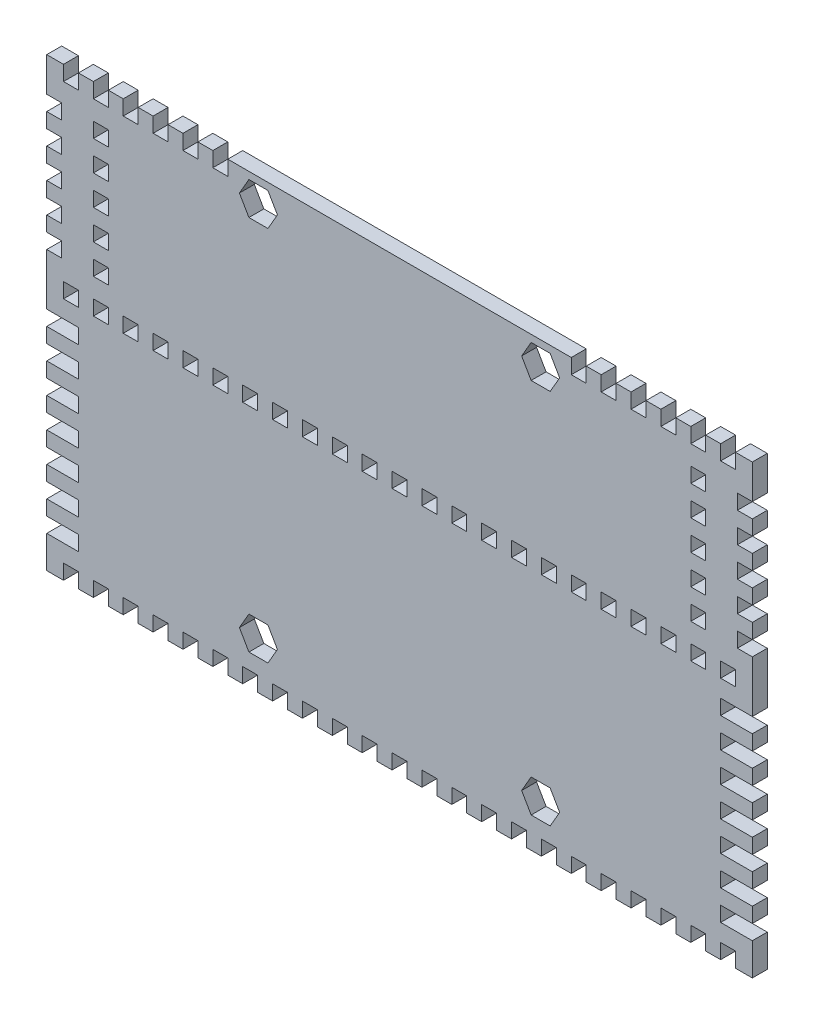
from build123d import *

# Parameters (mm, degrees)
SKETCH1_W                = 150
SKETCH1_H                = 55
BOSS_EXTRUDE1_DEPTH      = 3.175
CUT_EXTRUDE1_REACH       = 81.946
SKETCH2_W                = 3.175
SKETCH2_H                = 6.35
LPATTERN1_COUNT          = 12
LPATTERN1_PITCH          = 6.35
LPATTERN1_COL_COUNT      = 12
LPATTERN1_COL_PITCH      = 6.35
MIRROR1_COPY_1_REACH     = 81.946
MIRROR1_COPY_1_SKETCH_W  = 3.175
MIRROR1_COPY_1_SKETCH_H  = 6.35
MIRROR1_COPY_2_REACH     = 81.946
MIRROR1_COPY_2_SKETCH_W  = 3.175
MIRROR1_COPY_2_SKETCH_H  = 6.35
MIRROR1_COPY_3_REACH     = 81.946
MIRROR1_COPY_3_SKETCH_W  = 3.175
MIRROR1_COPY_3_SKETCH_H  = 6.35
MIRROR1_COPY_4_REACH     = 81.946
MIRROR1_COPY_4_SKETCH_W  = 3.175
MIRROR1_COPY_4_SKETCH_H  = 6.35
MIRROR1_COPY_5_REACH     = 81.946
MIRROR1_COPY_5_SKETCH_W  = 3.175
MIRROR1_COPY_5_SKETCH_H  = 6.35
MIRROR1_COPY_6_REACH     = 81.946
MIRROR1_COPY_6_SKETCH_W  = 3.175
MIRROR1_COPY_6_SKETCH_H  = 6.35
MIRROR1_COPY_7_REACH     = 81.946
MIRROR1_COPY_7_SKETCH_W  = 3.175
MIRROR1_COPY_7_SKETCH_H  = 6.35
MIRROR1_COPY_8_REACH     = 81.946
MIRROR1_COPY_8_SKETCH_W  = 3.175
MIRROR1_COPY_8_SKETCH_H  = 6.35
MIRROR1_COPY_9_REACH     = 81.946
MIRROR1_COPY_9_SKETCH_W  = 3.175
MIRROR1_COPY_9_SKETCH_H  = 6.35
MIRROR1_COPY_10_REACH    = 81.946
MIRROR1_COPY_10_SKETCH_W = 3.175
MIRROR1_COPY_10_SKETCH_H = 6.35
MIRROR1_COPY_11_REACH    = 81.946
MIRROR1_COPY_11_SKETCH_W = 3.175
MIRROR1_COPY_11_SKETCH_H = 6.35
MIRROR1_COPY_12_REACH    = 81.946
MIRROR1_COPY_12_SKETCH_W = 3.175
MIRROR1_COPY_12_SKETCH_H = 6.35
MIRROR1_COPY_13_REACH    = 81.946
MIRROR1_COPY_13_SKETCH_W = 3.175
MIRROR1_COPY_13_SKETCH_H = 6.35
MIRROR1_COPY_14_REACH    = 81.946
MIRROR1_COPY_14_SKETCH_W = 3.175
MIRROR1_COPY_14_SKETCH_H = 6.35
MIRROR1_COPY_15_REACH    = 81.946
MIRROR1_COPY_15_SKETCH_W = 3.175
MIRROR1_COPY_15_SKETCH_H = 6.35
MIRROR1_COPY_16_REACH    = 81.946
MIRROR1_COPY_16_SKETCH_W = 3.175
MIRROR1_COPY_16_SKETCH_H = 6.35
MIRROR1_COPY_17_REACH    = 81.946
MIRROR1_COPY_17_SKETCH_W = 3.175
MIRROR1_COPY_17_SKETCH_H = 6.35
MIRROR1_COPY_18_REACH    = 81.946
MIRROR1_COPY_18_SKETCH_W = 3.175
MIRROR1_COPY_18_SKETCH_H = 6.35
MIRROR1_COPY_19_REACH    = 81.946
MIRROR1_COPY_19_SKETCH_W = 3.175
MIRROR1_COPY_19_SKETCH_H = 6.35
MIRROR1_COPY_20_REACH    = 81.946
MIRROR1_COPY_20_SKETCH_W = 3.175
MIRROR1_COPY_20_SKETCH_H = 6.35
MIRROR1_COPY_21_REACH    = 81.946
MIRROR1_COPY_21_SKETCH_W = 3.175
MIRROR1_COPY_21_SKETCH_H = 6.35
MIRROR1_COPY_22_REACH    = 81.946
MIRROR1_COPY_22_SKETCH_W = 3.175
MIRROR1_COPY_22_SKETCH_H = 6.35
SKETCH3_W                = 6.35
SKETCH3_H                = 3.175
CUT_EXTRUDE2_DEPTH       = 10
LPATTERN2_COUNT          = 4
LPATTERN2_PITCH          = 6.35
LPATTERN2_COL_COUNT      = 4
LPATTERN2_COL_PITCH      = 6.35
MIRROR2_COPY_1_SKETCH_W  = 6.35
MIRROR2_COPY_1_SKETCH_H  = 3.175
MIRROR2_COPY_1_DEPTH     = 10
MIRROR2_COPY_2_SKETCH_W  = 6.35
MIRROR2_COPY_2_SKETCH_H  = 3.175
MIRROR2_COPY_2_DEPTH     = 10
MIRROR2_COPY_3_SKETCH_W  = 6.35
MIRROR2_COPY_3_SKETCH_H  = 3.175
MIRROR2_COPY_3_DEPTH     = 10
MIRROR2_COPY_4_SKETCH_W  = 6.35
MIRROR2_COPY_4_SKETCH_H  = 3.175
MIRROR2_COPY_4_DEPTH     = 10
MIRROR2_COPY_5_SKETCH_W  = 6.35
MIRROR2_COPY_5_SKETCH_H  = 3.175
MIRROR2_COPY_5_DEPTH     = 10
MIRROR2_COPY_6_SKETCH_W  = 6.35
MIRROR2_COPY_6_SKETCH_H  = 3.175
MIRROR2_COPY_6_DEPTH     = 10
SKETCH5_W                = 150
SKETCH5_H                = 40
BOSS_EXTRUDE2_DEPTH      = 3.175
CUT_EXTRUDE5_DEPTH       = 10
LPATTERN3_COUNT          = 12
LPATTERN3_PITCH          = 6.35
LPATTERN3_COL_COUNT      = 12
LPATTERN3_COL_PITCH      = 6.35
SKETCH8_W                = 3.5625
SKETCH8_H                = 3.175
CUT_EXTRUDE6_DEPTH       = 10
LPATTERN4_COUNT          = 7
LPATTERN4_PITCH          = 6.35
MIRROR3_COPY_1_SKETCH_W  = 3.5625
MIRROR3_COPY_1_SKETCH_H  = 3.175
MIRROR3_COPY_1_DEPTH     = 10
MIRROR3_COPY_2_SKETCH_W  = 3.5625
MIRROR3_COPY_2_SKETCH_H  = 3.175
MIRROR3_COPY_2_DEPTH     = 10
MIRROR3_COPY_3_SKETCH_W  = 3.5625
MIRROR3_COPY_3_SKETCH_H  = 3.175
MIRROR3_COPY_3_DEPTH     = 10
MIRROR3_COPY_4_SKETCH_W  = 3.5625
MIRROR3_COPY_4_SKETCH_H  = 3.175
MIRROR3_COPY_4_DEPTH     = 10
MIRROR3_COPY_5_SKETCH_W  = 3.5625
MIRROR3_COPY_5_SKETCH_H  = 3.175
MIRROR3_COPY_5_DEPTH     = 10
MIRROR3_COPY_6_SKETCH_W  = 3.5625
MIRROR3_COPY_6_SKETCH_H  = 3.175
MIRROR3_COPY_6_DEPTH     = 10
SKETCH11_W               = 73.025
SKETCH11_H               = 3.175
BOSS_EXTRUDE3_DEPTH      = 3.175
SKETCH10_R               = 2.5
CUT_EXTRUDE7_DEPTH       = 10
SKETCH12_W               = 6.35
SKETCH12_H               = 3.175
CUT_EXTRUDE8_DEPTH       = 10
LPATTERN5_COUNT          = 3
LPATTERN5_PITCH          = 6.35
LPATTERN5_COL_COUNT      = 3
LPATTERN5_COL_PITCH      = 6.35
MIRROR4_COPY_1_SKETCH_W  = 6.35
MIRROR4_COPY_1_SKETCH_H  = 3.175
MIRROR4_COPY_1_DEPTH     = 10
MIRROR4_COPY_2_SKETCH_W  = 6.35
MIRROR4_COPY_2_SKETCH_H  = 3.175
MIRROR4_COPY_2_DEPTH     = 10
MIRROR4_COPY_3_SKETCH_W  = 6.35
MIRROR4_COPY_3_SKETCH_H  = 3.175
MIRROR4_COPY_3_DEPTH     = 10
MIRROR4_COPY_4_SKETCH_W  = 6.35
MIRROR4_COPY_4_SKETCH_H  = 3.175
MIRROR4_COPY_4_DEPTH     = 10
SKETCH13_W               = 3.175
SKETCH13_H               = 3.175
CUT_EXTRUDE9_DEPTH       = 10
LPATTERN6_COUNT          = 3
LPATTERN6_PITCH          = 6.35
LPATTERN6_COL_COUNT      = 3
LPATTERN6_COL_PITCH      = 6.35
MIRROR5_COPY_1_SKETCH_W  = 3.175
MIRROR5_COPY_1_SKETCH_H  = 3.175
MIRROR5_COPY_1_DEPTH     = 10
MIRROR5_COPY_2_SKETCH_W  = 3.175
MIRROR5_COPY_2_SKETCH_H  = 3.175
MIRROR5_COPY_2_DEPTH     = 10
MIRROR5_COPY_3_SKETCH_W  = 3.175
MIRROR5_COPY_3_SKETCH_H  = 3.175
MIRROR5_COPY_3_DEPTH     = 10
MIRROR5_COPY_4_SKETCH_W  = 3.175
MIRROR5_COPY_4_SKETCH_H  = 3.175
MIRROR5_COPY_4_DEPTH     = 10
CUT_EXTRUDE10_DEPTH      = 10


with BuildPart() as part:
    # Sketch1 → Boss-Extrude1 (new body)
    with BuildSketch(Plane.XY):
        Rectangle(SKETCH1_W, SKETCH1_H)
    extrude(amount=BOSS_EXTRUDE1_DEPTH)

    # Sketch2 → Cut-Extrude1 (cut, up to next)
    with BuildSketch(Plane(origin=(0, 0, 0), x_dir=(-1, 0, 0), z_dir=(0, 0, -1)), mode=Mode.PRIVATE) as cut_extrude1_sk1:
        with Locations((0, 27.5)):
            Rectangle(SKETCH2_W, SKETCH2_H)
    cut_extrude1_tool1 = extrude(cut_extrude1_sk1.sketch, amount=-CUT_EXTRUDE1_REACH, mode=Mode.PRIVATE) & part.part
    cut_extrude1 = cut_extrude1_tool1.solids().sort_by_distance((0, 27.5, 0))[0]
    add(cut_extrude1, mode=Mode.SUBTRACT)

    # LPattern1: Cut-Extrude1 ×12
    with Locations(*[(i * LPATTERN1_PITCH, 0, 0) for i in range(1, LPATTERN1_COUNT)]):
        add(cut_extrude1, mode=Mode.SUBTRACT)

    # LPattern1 col: Cut-Extrude1 ×12
    with Locations(*[(-i * LPATTERN1_COL_PITCH, 0, 0) for i in range(1, LPATTERN1_COL_COUNT)]):
        add(cut_extrude1, mode=Mode.SUBTRACT)

    # Mirror1: Cut-Extrude1 across plane
    add(cut_extrude1.mirror(Plane.ZX), mode=Mode.SUBTRACT)

    # Mirror1 copy 1 sketch → Mirror1 copy 1 (cut, up to next)
    with BuildSketch(Plane(origin=(6.35, 0, 0), x_dir=(-1, 0, 0), z_dir=(0, 0, -1)), mode=Mode.PRIVATE) as mirror1_copy_1_sk1:
        with Locations((0, -27.5)):
            Rectangle(MIRROR1_COPY_1_SKETCH_W, MIRROR1_COPY_1_SKETCH_H)
    mirror1_copy_1_tool1 = extrude(mirror1_copy_1_sk1.sketch, amount=-MIRROR1_COPY_1_REACH, mode=Mode.PRIVATE) & part.part
    add(mirror1_copy_1_tool1.solids().sort_by_distance((6.35, -27.5, 0))[0], mode=Mode.SUBTRACT)

    # Mirror1 copy 2 sketch → Mirror1 copy 2 (cut, up to next)
    with BuildSketch(Plane(origin=(12.7, 0, 0), x_dir=(-1, 0, 0), z_dir=(0, 0, -1)), mode=Mode.PRIVATE) as mirror1_copy_2_sk1:
        with Locations((0, -27.5)):
            Rectangle(MIRROR1_COPY_2_SKETCH_W, MIRROR1_COPY_2_SKETCH_H)
    mirror1_copy_2_tool1 = extrude(mirror1_copy_2_sk1.sketch, amount=-MIRROR1_COPY_2_REACH, mode=Mode.PRIVATE) & part.part
    add(mirror1_copy_2_tool1.solids().sort_by_distance((12.7, -27.5, 0))[0], mode=Mode.SUBTRACT)

    # Mirror1 copy 3 sketch → Mirror1 copy 3 (cut, up to next)
    with BuildSketch(Plane(origin=(19.05, 0, 0), x_dir=(-1, 0, 0), z_dir=(0, 0, -1)), mode=Mode.PRIVATE) as mirror1_copy_3_sk1:
        with Locations((0, -27.5)):
            Rectangle(MIRROR1_COPY_3_SKETCH_W, MIRROR1_COPY_3_SKETCH_H)
    mirror1_copy_3_tool1 = extrude(mirror1_copy_3_sk1.sketch, amount=-MIRROR1_COPY_3_REACH, mode=Mode.PRIVATE) & part.part
    add(mirror1_copy_3_tool1.solids().sort_by_distance((19.05, -27.5, 0))[0], mode=Mode.SUBTRACT)

    # Mirror1 copy 4 sketch → Mirror1 copy 4 (cut, up to next)
    with BuildSketch(Plane(origin=(25.4, 0, 0), x_dir=(-1, 0, 0), z_dir=(0, 0, -1)), mode=Mode.PRIVATE) as mirror1_copy_4_sk1:
        with Locations((0, -27.5)):
            Rectangle(MIRROR1_COPY_4_SKETCH_W, MIRROR1_COPY_4_SKETCH_H)
    mirror1_copy_4_tool1 = extrude(mirror1_copy_4_sk1.sketch, amount=-MIRROR1_COPY_4_REACH, mode=Mode.PRIVATE) & part.part
    add(mirror1_copy_4_tool1.solids().sort_by_distance((25.4, -27.5, 0))[0], mode=Mode.SUBTRACT)

    # Mirror1 copy 5 sketch → Mirror1 copy 5 (cut, up to next)
    with BuildSketch(Plane(origin=(31.75, 0, 0), x_dir=(-1, 0, 0), z_dir=(0, 0, -1)), mode=Mode.PRIVATE) as mirror1_copy_5_sk1:
        with Locations((0, -27.5)):
            Rectangle(MIRROR1_COPY_5_SKETCH_W, MIRROR1_COPY_5_SKETCH_H)
    mirror1_copy_5_tool1 = extrude(mirror1_copy_5_sk1.sketch, amount=-MIRROR1_COPY_5_REACH, mode=Mode.PRIVATE) & part.part
    add(mirror1_copy_5_tool1.solids().sort_by_distance((31.75, -27.5, 0))[0], mode=Mode.SUBTRACT)

    # Mirror1 copy 6 sketch → Mirror1 copy 6 (cut, up to next)
    with BuildSketch(Plane(origin=(38.1, 0, 0), x_dir=(-1, 0, 0), z_dir=(0, 0, -1)), mode=Mode.PRIVATE) as mirror1_copy_6_sk1:
        with Locations((0, -27.5)):
            Rectangle(MIRROR1_COPY_6_SKETCH_W, MIRROR1_COPY_6_SKETCH_H)
    mirror1_copy_6_tool1 = extrude(mirror1_copy_6_sk1.sketch, amount=-MIRROR1_COPY_6_REACH, mode=Mode.PRIVATE) & part.part
    add(mirror1_copy_6_tool1.solids().sort_by_distance((38.1, -27.5, 0))[0], mode=Mode.SUBTRACT)

    # Mirror1 copy 7 sketch → Mirror1 copy 7 (cut, up to next)
    with BuildSketch(Plane(origin=(44.45, 0, 0), x_dir=(-1, 0, 0), z_dir=(0, 0, -1)), mode=Mode.PRIVATE) as mirror1_copy_7_sk1:
        with Locations((0, -27.5)):
            Rectangle(MIRROR1_COPY_7_SKETCH_W, MIRROR1_COPY_7_SKETCH_H)
    mirror1_copy_7_tool1 = extrude(mirror1_copy_7_sk1.sketch, amount=-MIRROR1_COPY_7_REACH, mode=Mode.PRIVATE) & part.part
    add(mirror1_copy_7_tool1.solids().sort_by_distance((44.45, -27.5, 0))[0], mode=Mode.SUBTRACT)

    # Mirror1 copy 8 sketch → Mirror1 copy 8 (cut, up to next)
    with BuildSketch(Plane(origin=(50.8, 0, 0), x_dir=(-1, 0, 0), z_dir=(0, 0, -1)), mode=Mode.PRIVATE) as mirror1_copy_8_sk1:
        with Locations((0, -27.5)):
            Rectangle(MIRROR1_COPY_8_SKETCH_W, MIRROR1_COPY_8_SKETCH_H)
    mirror1_copy_8_tool1 = extrude(mirror1_copy_8_sk1.sketch, amount=-MIRROR1_COPY_8_REACH, mode=Mode.PRIVATE) & part.part
    add(mirror1_copy_8_tool1.solids().sort_by_distance((50.8, -27.5, 0))[0], mode=Mode.SUBTRACT)

    # Mirror1 copy 9 sketch → Mirror1 copy 9 (cut, up to next)
    with BuildSketch(Plane(origin=(57.15, 0, 0), x_dir=(-1, 0, 0), z_dir=(0, 0, -1)), mode=Mode.PRIVATE) as mirror1_copy_9_sk1:
        with Locations((0, -27.5)):
            Rectangle(MIRROR1_COPY_9_SKETCH_W, MIRROR1_COPY_9_SKETCH_H)
    mirror1_copy_9_tool1 = extrude(mirror1_copy_9_sk1.sketch, amount=-MIRROR1_COPY_9_REACH, mode=Mode.PRIVATE) & part.part
    add(mirror1_copy_9_tool1.solids().sort_by_distance((57.15, -27.5, 0))[0], mode=Mode.SUBTRACT)

    # Mirror1 copy 10 sketch → Mirror1 copy 10 (cut, up to next)
    with BuildSketch(Plane(origin=(63.5, 0, 0), x_dir=(-1, 0, 0), z_dir=(0, 0, -1)), mode=Mode.PRIVATE) as mirror1_copy_10_sk1:
        with Locations((0, -27.5)):
            Rectangle(MIRROR1_COPY_10_SKETCH_W, MIRROR1_COPY_10_SKETCH_H)
    mirror1_copy_10_tool1 = extrude(mirror1_copy_10_sk1.sketch, amount=-MIRROR1_COPY_10_REACH, mode=Mode.PRIVATE) & part.part
    add(mirror1_copy_10_tool1.solids().sort_by_distance((63.5, -27.5, 0))[0], mode=Mode.SUBTRACT)

    # Mirror1 copy 11 sketch → Mirror1 copy 11 (cut, up to next)
    with BuildSketch(Plane(origin=(69.85, 0, 0), x_dir=(-1, 0, 0), z_dir=(0, 0, -1)), mode=Mode.PRIVATE) as mirror1_copy_11_sk1:
        with Locations((0, -27.5)):
            Rectangle(MIRROR1_COPY_11_SKETCH_W, MIRROR1_COPY_11_SKETCH_H)
    mirror1_copy_11_tool1 = extrude(mirror1_copy_11_sk1.sketch, amount=-MIRROR1_COPY_11_REACH, mode=Mode.PRIVATE) & part.part
    add(mirror1_copy_11_tool1.solids().sort_by_distance((69.85, -27.5, 0))[0], mode=Mode.SUBTRACT)

    # Mirror1 copy 12 sketch → Mirror1 copy 12 (cut, up to next)
    with BuildSketch(Plane(origin=(-6.35, 0, 0), x_dir=(-1, 0, 0), z_dir=(0, 0, -1)), mode=Mode.PRIVATE) as mirror1_copy_12_sk1:
        with Locations((0, -27.5)):
            Rectangle(MIRROR1_COPY_12_SKETCH_W, MIRROR1_COPY_12_SKETCH_H)
    mirror1_copy_12_tool1 = extrude(mirror1_copy_12_sk1.sketch, amount=-MIRROR1_COPY_12_REACH, mode=Mode.PRIVATE) & part.part
    add(mirror1_copy_12_tool1.solids().sort_by_distance((-6.35, -27.5, 0))[0], mode=Mode.SUBTRACT)

    # Mirror1 copy 13 sketch → Mirror1 copy 13 (cut, up to next)
    with BuildSketch(Plane(origin=(-12.7, 0, 0), x_dir=(-1, 0, 0), z_dir=(0, 0, -1)), mode=Mode.PRIVATE) as mirror1_copy_13_sk1:
        with Locations((0, -27.5)):
            Rectangle(MIRROR1_COPY_13_SKETCH_W, MIRROR1_COPY_13_SKETCH_H)
    mirror1_copy_13_tool1 = extrude(mirror1_copy_13_sk1.sketch, amount=-MIRROR1_COPY_13_REACH, mode=Mode.PRIVATE) & part.part
    add(mirror1_copy_13_tool1.solids().sort_by_distance((-12.7, -27.5, 0))[0], mode=Mode.SUBTRACT)

    # Mirror1 copy 14 sketch → Mirror1 copy 14 (cut, up to next)
    with BuildSketch(Plane(origin=(-19.05, 0, 0), x_dir=(-1, 0, 0), z_dir=(0, 0, -1)), mode=Mode.PRIVATE) as mirror1_copy_14_sk1:
        with Locations((0, -27.5)):
            Rectangle(MIRROR1_COPY_14_SKETCH_W, MIRROR1_COPY_14_SKETCH_H)
    mirror1_copy_14_tool1 = extrude(mirror1_copy_14_sk1.sketch, amount=-MIRROR1_COPY_14_REACH, mode=Mode.PRIVATE) & part.part
    add(mirror1_copy_14_tool1.solids().sort_by_distance((-19.05, -27.5, 0))[0], mode=Mode.SUBTRACT)

    # Mirror1 copy 15 sketch → Mirror1 copy 15 (cut, up to next)
    with BuildSketch(Plane(origin=(-25.4, 0, 0), x_dir=(-1, 0, 0), z_dir=(0, 0, -1)), mode=Mode.PRIVATE) as mirror1_copy_15_sk1:
        with Locations((0, -27.5)):
            Rectangle(MIRROR1_COPY_15_SKETCH_W, MIRROR1_COPY_15_SKETCH_H)
    mirror1_copy_15_tool1 = extrude(mirror1_copy_15_sk1.sketch, amount=-MIRROR1_COPY_15_REACH, mode=Mode.PRIVATE) & part.part
    add(mirror1_copy_15_tool1.solids().sort_by_distance((-25.4, -27.5, 0))[0], mode=Mode.SUBTRACT)

    # Mirror1 copy 16 sketch → Mirror1 copy 16 (cut, up to next)
    with BuildSketch(Plane(origin=(-31.75, 0, 0), x_dir=(-1, 0, 0), z_dir=(0, 0, -1)), mode=Mode.PRIVATE) as mirror1_copy_16_sk1:
        with Locations((0, -27.5)):
            Rectangle(MIRROR1_COPY_16_SKETCH_W, MIRROR1_COPY_16_SKETCH_H)
    mirror1_copy_16_tool1 = extrude(mirror1_copy_16_sk1.sketch, amount=-MIRROR1_COPY_16_REACH, mode=Mode.PRIVATE) & part.part
    add(mirror1_copy_16_tool1.solids().sort_by_distance((-31.75, -27.5, 0))[0], mode=Mode.SUBTRACT)

    # Mirror1 copy 17 sketch → Mirror1 copy 17 (cut, up to next)
    with BuildSketch(Plane(origin=(-38.1, 0, 0), x_dir=(-1, 0, 0), z_dir=(0, 0, -1)), mode=Mode.PRIVATE) as mirror1_copy_17_sk1:
        with Locations((0, -27.5)):
            Rectangle(MIRROR1_COPY_17_SKETCH_W, MIRROR1_COPY_17_SKETCH_H)
    mirror1_copy_17_tool1 = extrude(mirror1_copy_17_sk1.sketch, amount=-MIRROR1_COPY_17_REACH, mode=Mode.PRIVATE) & part.part
    add(mirror1_copy_17_tool1.solids().sort_by_distance((-38.1, -27.5, 0))[0], mode=Mode.SUBTRACT)

    # Mirror1 copy 18 sketch → Mirror1 copy 18 (cut, up to next)
    with BuildSketch(Plane(origin=(-44.45, 0, 0), x_dir=(-1, 0, 0), z_dir=(0, 0, -1)), mode=Mode.PRIVATE) as mirror1_copy_18_sk1:
        with Locations((0, -27.5)):
            Rectangle(MIRROR1_COPY_18_SKETCH_W, MIRROR1_COPY_18_SKETCH_H)
    mirror1_copy_18_tool1 = extrude(mirror1_copy_18_sk1.sketch, amount=-MIRROR1_COPY_18_REACH, mode=Mode.PRIVATE) & part.part
    add(mirror1_copy_18_tool1.solids().sort_by_distance((-44.45, -27.5, 0))[0], mode=Mode.SUBTRACT)

    # Mirror1 copy 19 sketch → Mirror1 copy 19 (cut, up to next)
    with BuildSketch(Plane(origin=(-50.8, 0, 0), x_dir=(-1, 0, 0), z_dir=(0, 0, -1)), mode=Mode.PRIVATE) as mirror1_copy_19_sk1:
        with Locations((0, -27.5)):
            Rectangle(MIRROR1_COPY_19_SKETCH_W, MIRROR1_COPY_19_SKETCH_H)
    mirror1_copy_19_tool1 = extrude(mirror1_copy_19_sk1.sketch, amount=-MIRROR1_COPY_19_REACH, mode=Mode.PRIVATE) & part.part
    add(mirror1_copy_19_tool1.solids().sort_by_distance((-50.8, -27.5, 0))[0], mode=Mode.SUBTRACT)

    # Mirror1 copy 20 sketch → Mirror1 copy 20 (cut, up to next)
    with BuildSketch(Plane(origin=(-57.15, 0, 0), x_dir=(-1, 0, 0), z_dir=(0, 0, -1)), mode=Mode.PRIVATE) as mirror1_copy_20_sk1:
        with Locations((0, -27.5)):
            Rectangle(MIRROR1_COPY_20_SKETCH_W, MIRROR1_COPY_20_SKETCH_H)
    mirror1_copy_20_tool1 = extrude(mirror1_copy_20_sk1.sketch, amount=-MIRROR1_COPY_20_REACH, mode=Mode.PRIVATE) & part.part
    add(mirror1_copy_20_tool1.solids().sort_by_distance((-57.15, -27.5, 0))[0], mode=Mode.SUBTRACT)

    # Mirror1 copy 21 sketch → Mirror1 copy 21 (cut, up to next)
    with BuildSketch(Plane(origin=(-63.5, 0, 0), x_dir=(-1, 0, 0), z_dir=(0, 0, -1)), mode=Mode.PRIVATE) as mirror1_copy_21_sk1:
        with Locations((0, -27.5)):
            Rectangle(MIRROR1_COPY_21_SKETCH_W, MIRROR1_COPY_21_SKETCH_H)
    mirror1_copy_21_tool1 = extrude(mirror1_copy_21_sk1.sketch, amount=-MIRROR1_COPY_21_REACH, mode=Mode.PRIVATE) & part.part
    add(mirror1_copy_21_tool1.solids().sort_by_distance((-63.5, -27.5, 0))[0], mode=Mode.SUBTRACT)

    # Mirror1 copy 22 sketch → Mirror1 copy 22 (cut, up to next)
    with BuildSketch(Plane(origin=(-69.85, 0, 0), x_dir=(-1, 0, 0), z_dir=(0, 0, -1)), mode=Mode.PRIVATE) as mirror1_copy_22_sk1:
        with Locations((0, -27.5)):
            Rectangle(MIRROR1_COPY_22_SKETCH_W, MIRROR1_COPY_22_SKETCH_H)
    mirror1_copy_22_tool1 = extrude(mirror1_copy_22_sk1.sketch, amount=-MIRROR1_COPY_22_REACH, mode=Mode.PRIVATE) & part.part
    add(mirror1_copy_22_tool1.solids().sort_by_distance((-69.85, -27.5, 0))[0], mode=Mode.SUBTRACT)

    # Sketch3 → Cut-Extrude2 (cut)
    with BuildSketch(Plane(origin=(0, 0, 0), x_dir=(-1, 0, 0), z_dir=(0, 0, -1))):
        with Locations((-75, 0)):
            Rectangle(SKETCH3_W, SKETCH3_H)
    cut_extrude2 = extrude(amount=-CUT_EXTRUDE2_DEPTH, mode=Mode.SUBTRACT)

    # LPattern2: Cut-Extrude2 ×4
    with Locations(*[(0, i * LPATTERN2_PITCH, 0) for i in range(1, LPATTERN2_COUNT)]):
        add(cut_extrude2, mode=Mode.SUBTRACT)

    # LPattern2 col: Cut-Extrude2 ×4
    with Locations(*[(0, -i * LPATTERN2_COL_PITCH, 0) for i in range(1, LPATTERN2_COL_COUNT)]):
        add(cut_extrude2, mode=Mode.SUBTRACT)

    # Mirror2: Cut-Extrude2 across plane
    add(cut_extrude2.mirror(Plane(origin=(0, 0, 0), x_dir=(0, 0, 1), z_dir=(1, 0, 0))), mode=Mode.SUBTRACT)

    # Mirror2 copy 1 sketch → Mirror2 copy 1 (cut)
    with BuildSketch(Plane(origin=(0, 6.35, 0), x_dir=(1, 0, 0), z_dir=(0, 0, -1))):
        with Locations((-75, 0)):
            Rectangle(MIRROR2_COPY_1_SKETCH_W, MIRROR2_COPY_1_SKETCH_H)
    extrude(amount=-MIRROR2_COPY_1_DEPTH, mode=Mode.SUBTRACT)

    # Mirror2 copy 2 sketch → Mirror2 copy 2 (cut)
    with BuildSketch(Plane(origin=(0, 12.7, 0), x_dir=(1, 0, 0), z_dir=(0, 0, -1))):
        with Locations((-75, 0)):
            Rectangle(MIRROR2_COPY_2_SKETCH_W, MIRROR2_COPY_2_SKETCH_H)
    extrude(amount=-MIRROR2_COPY_2_DEPTH, mode=Mode.SUBTRACT)

    # Mirror2 copy 3 sketch → Mirror2 copy 3 (cut)
    with BuildSketch(Plane(origin=(0, 19.05, 0), x_dir=(1, 0, 0), z_dir=(0, 0, -1))):
        with Locations((-75, 0)):
            Rectangle(MIRROR2_COPY_3_SKETCH_W, MIRROR2_COPY_3_SKETCH_H)
    extrude(amount=-MIRROR2_COPY_3_DEPTH, mode=Mode.SUBTRACT)

    # Mirror2 copy 4 sketch → Mirror2 copy 4 (cut)
    with BuildSketch(Plane(origin=(0, -6.35, 0), x_dir=(1, 0, 0), z_dir=(0, 0, -1))):
        with Locations((-75, 0)):
            Rectangle(MIRROR2_COPY_4_SKETCH_W, MIRROR2_COPY_4_SKETCH_H)
    extrude(amount=-MIRROR2_COPY_4_DEPTH, mode=Mode.SUBTRACT)

    # Mirror2 copy 5 sketch → Mirror2 copy 5 (cut)
    with BuildSketch(Plane(origin=(0, -12.7, 0), x_dir=(1, 0, 0), z_dir=(0, 0, -1))):
        with Locations((-75, 0)):
            Rectangle(MIRROR2_COPY_5_SKETCH_W, MIRROR2_COPY_5_SKETCH_H)
    extrude(amount=-MIRROR2_COPY_5_DEPTH, mode=Mode.SUBTRACT)

    # Mirror2 copy 6 sketch → Mirror2 copy 6 (cut)
    with BuildSketch(Plane(origin=(0, -19.05, 0), x_dir=(1, 0, 0), z_dir=(0, 0, -1))):
        with Locations((-75, 0)):
            Rectangle(MIRROR2_COPY_6_SKETCH_W, MIRROR2_COPY_6_SKETCH_H)
    extrude(amount=-MIRROR2_COPY_6_DEPTH, mode=Mode.SUBTRACT)

    # Sketch5 → Boss-Extrude2 (add)
    with BuildSketch(Plane(origin=(0, 0, 0), x_dir=(-1, 0, 0), z_dir=(0, 0, -1))):
        with Locations((0, 47.5)):
            Rectangle(SKETCH5_W, SKETCH5_H)
    extrude(amount=-BOSS_EXTRUDE2_DEPTH)

    # Sketch7 → Cut-Extrude5 (cut)
    with BuildSketch(Plane(origin=(0, 0, 0), x_dir=(-1, 0, 0), z_dir=(0, 0, -1))):
        Polygon((0, 67.5), (1.5875, 67.5), (1.5875, 64.325), (0, 64.325), (-1.5875, 64.325), (-1.5875, 67.5), align=None)
    cut_extrude5 = extrude(amount=-CUT_EXTRUDE5_DEPTH, mode=Mode.SUBTRACT)

    # LPattern3: Cut-Extrude5 ×12
    with Locations(*[(i * LPATTERN3_PITCH, 0, 0) for i in range(1, LPATTERN3_COUNT)]):
        add(cut_extrude5, mode=Mode.SUBTRACT)

    # LPattern3 col: Cut-Extrude5 ×12
    with Locations(*[(-i * LPATTERN3_COL_PITCH, 0, 0) for i in range(1, LPATTERN3_COL_COUNT)]):
        add(cut_extrude5, mode=Mode.SUBTRACT)

    # Sketch8 → Cut-Extrude6 (cut)
    with BuildSketch(Plane(origin=(0, 0, 0), x_dir=(-1, 0, 0), z_dir=(0, 0, -1))):
        with Locations((-70.04375, 19.05)):
            Rectangle(SKETCH8_W, SKETCH8_H)
    cut_extrude6 = extrude(amount=-CUT_EXTRUDE6_DEPTH, mode=Mode.SUBTRACT)

    # LPattern4: Cut-Extrude6 ×7
    with Locations(*[(0, -i * LPATTERN4_PITCH, 0) for i in range(1, LPATTERN4_COUNT)]):
        add(cut_extrude6, mode=Mode.SUBTRACT)

    # Mirror3: Cut-Extrude6 across plane
    add(cut_extrude6.mirror(Plane(origin=(0, 0, 0), x_dir=(0, 0, 1), z_dir=(1, 0, 0))), mode=Mode.SUBTRACT)

    # Mirror3 copy 1 sketch → Mirror3 copy 1 (cut)
    with BuildSketch(Plane(origin=(0, -6.35, 0), x_dir=(1, 0, 0), z_dir=(0, 0, -1))):
        with Locations((-70.04375, -19.05)):
            Rectangle(MIRROR3_COPY_1_SKETCH_W, MIRROR3_COPY_1_SKETCH_H)
    extrude(amount=-MIRROR3_COPY_1_DEPTH, mode=Mode.SUBTRACT)

    # Mirror3 copy 2 sketch → Mirror3 copy 2 (cut)
    with BuildSketch(Plane(origin=(0, -12.7, 0), x_dir=(1, 0, 0), z_dir=(0, 0, -1))):
        with Locations((-70.04375, -19.05)):
            Rectangle(MIRROR3_COPY_2_SKETCH_W, MIRROR3_COPY_2_SKETCH_H)
    extrude(amount=-MIRROR3_COPY_2_DEPTH, mode=Mode.SUBTRACT)

    # Mirror3 copy 3 sketch → Mirror3 copy 3 (cut)
    with BuildSketch(Plane(origin=(0, -19.05, 0), x_dir=(1, 0, 0), z_dir=(0, 0, -1))):
        with Locations((-70.04375, -19.05)):
            Rectangle(MIRROR3_COPY_3_SKETCH_W, MIRROR3_COPY_3_SKETCH_H)
    extrude(amount=-MIRROR3_COPY_3_DEPTH, mode=Mode.SUBTRACT)

    # Mirror3 copy 4 sketch → Mirror3 copy 4 (cut)
    with BuildSketch(Plane(origin=(0, -25.4, 0), x_dir=(1, 0, 0), z_dir=(0, 0, -1))):
        with Locations((-70.04375, -19.05)):
            Rectangle(MIRROR3_COPY_4_SKETCH_W, MIRROR3_COPY_4_SKETCH_H)
    extrude(amount=-MIRROR3_COPY_4_DEPTH, mode=Mode.SUBTRACT)

    # Mirror3 copy 5 sketch → Mirror3 copy 5 (cut)
    with BuildSketch(Plane(origin=(0, -31.75, 0), x_dir=(1, 0, 0), z_dir=(0, 0, -1))):
        with Locations((-70.04375, -19.05)):
            Rectangle(MIRROR3_COPY_5_SKETCH_W, MIRROR3_COPY_5_SKETCH_H)
    extrude(amount=-MIRROR3_COPY_5_DEPTH, mode=Mode.SUBTRACT)

    # Mirror3 copy 6 sketch → Mirror3 copy 6 (cut)
    with BuildSketch(Plane(origin=(0, -38.1, 0), x_dir=(1, 0, 0), z_dir=(0, 0, -1))):
        with Locations((-70.04375, -19.05)):
            Rectangle(MIRROR3_COPY_6_SKETCH_W, MIRROR3_COPY_6_SKETCH_H)
    extrude(amount=-MIRROR3_COPY_6_DEPTH, mode=Mode.SUBTRACT)

    # Sketch11 → Boss-Extrude3 (add)
    with BuildSketch(Plane(origin=(0, 0, 0), x_dir=(-1, 0, 0), z_dir=(0, 0, -1))):
        with Locations((0, 65.9125)):
            Rectangle(SKETCH11_W, SKETCH11_H)
    extrude(amount=-BOSS_EXTRUDE3_DEPTH)

    # Sketch10 → Cut-Extrude7 (cut)
    with BuildSketch(Plane(origin=(0, 0, 0), x_dir=(-1, 0, 0), z_dir=(0, 0, -1))):
        with Locations((-30, 62.5)):
            Circle(SKETCH10_R)
        with Locations((30, 62.5)):
            Circle(SKETCH10_R)
        with Locations((30, -17.5)):
            Circle(SKETCH10_R)
        with Locations((-30, -17.5)):
            Circle(SKETCH10_R)
    extrude(amount=-CUT_EXTRUDE7_DEPTH, mode=Mode.SUBTRACT)

    # Sketch12 → Cut-Extrude8 (cut)
    with BuildSketch(Plane(origin=(0, 0, 0), x_dir=(-1, 0, 0), z_dir=(0, 0, -1))):
        with Locations((-75, 45.9125)):
            Rectangle(SKETCH12_W, SKETCH12_H)
    cut_extrude8 = extrude(amount=-CUT_EXTRUDE8_DEPTH, mode=Mode.SUBTRACT)

    # LPattern5: Cut-Extrude8 ×3
    with Locations(*[(0, i * LPATTERN5_PITCH, 0) for i in range(1, LPATTERN5_COUNT)]):
        add(cut_extrude8, mode=Mode.SUBTRACT)

    # LPattern5 col: Cut-Extrude8 ×3
    with Locations(*[(0, -i * LPATTERN5_COL_PITCH, 0) for i in range(1, LPATTERN5_COL_COUNT)]):
        add(cut_extrude8, mode=Mode.SUBTRACT)

    # Mirror4: Cut-Extrude8 across plane
    add(cut_extrude8.mirror(Plane(origin=(0, 0, 0), x_dir=(0, 0, 1), z_dir=(1, 0, 0))), mode=Mode.SUBTRACT)

    # Mirror4 copy 1 sketch → Mirror4 copy 1 (cut)
    with BuildSketch(Plane(origin=(0, 6.35, 0), x_dir=(1, 0, 0), z_dir=(0, 0, -1))):
        with Locations((-75, -45.9125)):
            Rectangle(MIRROR4_COPY_1_SKETCH_W, MIRROR4_COPY_1_SKETCH_H)
    extrude(amount=-MIRROR4_COPY_1_DEPTH, mode=Mode.SUBTRACT)

    # Mirror4 copy 2 sketch → Mirror4 copy 2 (cut)
    with BuildSketch(Plane(origin=(0, 12.7, 0), x_dir=(1, 0, 0), z_dir=(0, 0, -1))):
        with Locations((-75, -45.9125)):
            Rectangle(MIRROR4_COPY_2_SKETCH_W, MIRROR4_COPY_2_SKETCH_H)
    extrude(amount=-MIRROR4_COPY_2_DEPTH, mode=Mode.SUBTRACT)

    # Mirror4 copy 3 sketch → Mirror4 copy 3 (cut)
    with BuildSketch(Plane(origin=(0, -6.35, 0), x_dir=(1, 0, 0), z_dir=(0, 0, -1))):
        with Locations((-75, -45.9125)):
            Rectangle(MIRROR4_COPY_3_SKETCH_W, MIRROR4_COPY_3_SKETCH_H)
    extrude(amount=-MIRROR4_COPY_3_DEPTH, mode=Mode.SUBTRACT)

    # Mirror4 copy 4 sketch → Mirror4 copy 4 (cut)
    with BuildSketch(Plane(origin=(0, -12.7, 0), x_dir=(1, 0, 0), z_dir=(0, 0, -1))):
        with Locations((-75, -45.9125)):
            Rectangle(MIRROR4_COPY_4_SKETCH_W, MIRROR4_COPY_4_SKETCH_H)
    extrude(amount=-MIRROR4_COPY_4_DEPTH, mode=Mode.SUBTRACT)

    # Sketch13 → Cut-Extrude9 (cut)
    with BuildSketch(Plane(origin=(0, 0, 0), x_dir=(-1, 0, 0), z_dir=(0, 0, -1))):
        with Locations((-63.5, 45.9125)):
            Rectangle(SKETCH13_W, SKETCH13_H)
    cut_extrude9 = extrude(amount=-CUT_EXTRUDE9_DEPTH, mode=Mode.SUBTRACT)

    # LPattern6: Cut-Extrude9 ×3
    with Locations(*[(0, i * LPATTERN6_PITCH, 0) for i in range(1, LPATTERN6_COUNT)]):
        add(cut_extrude9, mode=Mode.SUBTRACT)

    # LPattern6 col: Cut-Extrude9 ×3
    with Locations(*[(0, -i * LPATTERN6_COL_PITCH, 0) for i in range(1, LPATTERN6_COL_COUNT)]):
        add(cut_extrude9, mode=Mode.SUBTRACT)

    # Mirror5: Cut-Extrude9 across plane
    add(cut_extrude9.mirror(Plane(origin=(0, 0, 0), x_dir=(0, 0, 1), z_dir=(1, 0, 0))), mode=Mode.SUBTRACT)

    # Mirror5 copy 1 sketch → Mirror5 copy 1 (cut)
    with BuildSketch(Plane(origin=(0, 6.35, 0), x_dir=(1, 0, 0), z_dir=(0, 0, -1))):
        with Locations((-63.5, -45.9125)):
            Rectangle(MIRROR5_COPY_1_SKETCH_W, MIRROR5_COPY_1_SKETCH_H)
    extrude(amount=-MIRROR5_COPY_1_DEPTH, mode=Mode.SUBTRACT)

    # Mirror5 copy 2 sketch → Mirror5 copy 2 (cut)
    with BuildSketch(Plane(origin=(0, 12.7, 0), x_dir=(1, 0, 0), z_dir=(0, 0, -1))):
        with Locations((-63.5, -45.9125)):
            Rectangle(MIRROR5_COPY_2_SKETCH_W, MIRROR5_COPY_2_SKETCH_H)
    extrude(amount=-MIRROR5_COPY_2_DEPTH, mode=Mode.SUBTRACT)

    # Mirror5 copy 3 sketch → Mirror5 copy 3 (cut)
    with BuildSketch(Plane(origin=(0, -6.35, 0), x_dir=(1, 0, 0), z_dir=(0, 0, -1))):
        with Locations((-63.5, -45.9125)):
            Rectangle(MIRROR5_COPY_3_SKETCH_W, MIRROR5_COPY_3_SKETCH_H)
    extrude(amount=-MIRROR5_COPY_3_DEPTH, mode=Mode.SUBTRACT)

    # Mirror5 copy 4 sketch → Mirror5 copy 4 (cut)
    with BuildSketch(Plane(origin=(0, -12.7, 0), x_dir=(1, 0, 0), z_dir=(0, 0, -1))):
        with Locations((-63.5, -45.9125)):
            Rectangle(MIRROR5_COPY_4_SKETCH_W, MIRROR5_COPY_4_SKETCH_H)
    extrude(amount=-MIRROR5_COPY_4_DEPTH, mode=Mode.SUBTRACT)

    # Sketch14 → Cut-Extrude10 (cut)
    with BuildSketch(Plane(origin=(0, 0, 0), x_dir=(-1, 0, 0), z_dir=(0, 0, -1))):
        Polygon((-25.958548116, 62.5), (-27.979274058, 66), (-32.020725942, 66), (-34.041451884, 62.5), (-32.020725942, 59), (-27.979274058, 59), align=None)
        Polygon((25.958548116, 62.5), (27.979274058, 59), (32.020725942, 59), (34.041451884, 62.5), (32.020725942, 66), (27.979274058, 66), align=None)
        Polygon((25.958548116, -17.5), (27.979274058, -21), (32.020725942, -21), (34.041451884, -17.5), (32.020725942, -14), (27.979274058, -14), align=None)
        Polygon((-25.958548116, -17.5), (-27.979274058, -14), (-32.020725942, -14), (-34.041451884, -17.5), (-32.020725942, -21), (-27.979274058, -21), align=None)
    extrude(amount=-CUT_EXTRUDE10_DEPTH, mode=Mode.SUBTRACT)


solid = part.part
